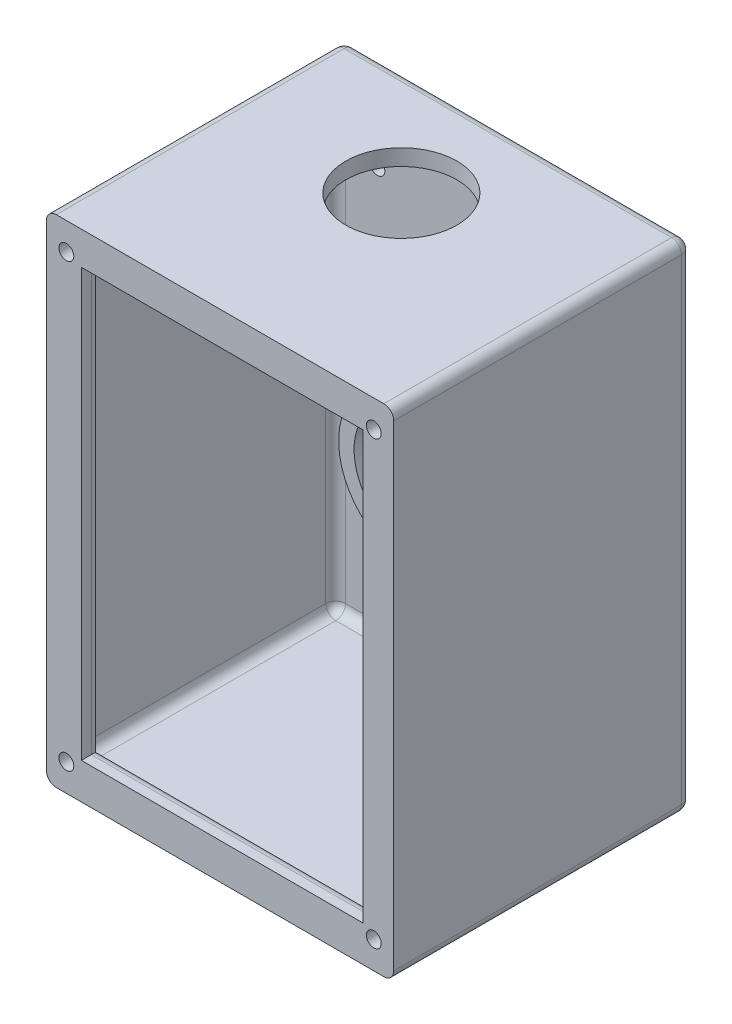
from build123d import *

# Parameters (mm, degrees)
ESBO_O1_W                   = 70
ESBO_O1_H                   = 100
ESBO_O1_R                   = 12
RESSALTO_EXTRUS_O1_DEPTH    = 4
ESBO_O2_R                   = 15.102889219
ESBO_O2_R_2                 = 12
RESSALTO_EXTRUS_O2_DEPTH    = 21
ESBO_O3_W                   = 70
ESBO_O3_H                   = 100
ESBO_O3_W_2                 = 65.412301245
ESBO_O3_H_2                 = 93.446144636
RESSALTO_EXTRUS_O3_DEPTH    = 60
FILETE1_R                   = 2
FILETE2_R                   = 2
FILETE3_R                   = 2
FILETE4_R                   = 2
FILETE5_R                   = 2
CORTE_EXTRUS_O1_DEPTH       = 17
CORTE_EXTRUS_O1_DEPTH_BACK  = 14
ESBO_O4_R                   = 1.5
FILETE6_R                   = 2
FILETE7_R                   = 2
RESSALTO_EXTRUS_O4_DEPTH    = 4
CORTE_EXTRUS_O2_DEPTH       = 4
CORTE_EXTRUS_O2_DEPTH_BACK  = 14
ESBO_O5_R                   = 1.5
FILETE8_R                   = 2
CORTE_EXTRUS_O10_DEPTH      = 32
CORTE_EXTRUS_O10_DEPTH_BACK = 22
ESBO_O6_R                   = 11.2


with BuildPart() as part:
    # Esboço1 → Ressalto-extrusão1 (new body)
    with BuildSketch(Plane.XY):
        with Locations((5.878926005, -32.438162544)):
            Rectangle(ESBO_O1_W, ESBO_O1_H)
        with Locations((5.878926005, -32.438162544)):
            Circle(ESBO_O1_R, mode=Mode.SUBTRACT)
    extrude(amount=RESSALTO_EXTRUS_O1_DEPTH)

    # Esboço2 → Ressalto-extrusão2 (add)
    with BuildSketch(Plane.XY):
        with Locations(Location((5.878926005, -32.438162544, 0), (0, 0, 180))):
            Circle(ESBO_O2_R)
        with Locations((5.878926005, -32.438162544)):
            Circle(ESBO_O2_R_2, mode=Mode.SUBTRACT)
    extrude(amount=RESSALTO_EXTRUS_O2_DEPTH)

    # Esboço3 → Ressalto-extrusão3 (add)
    with BuildSketch(Plane.XY):
        with Locations((5.878926005, -32.438162544)):
            Rectangle(ESBO_O3_W, ESBO_O3_H)
        with Locations((5.878926006, -32.438162544)):
            Rectangle(ESBO_O3_W_2, ESBO_O3_H_2, mode=Mode.SUBTRACT)
    extrude(amount=RESSALTO_EXTRUS_O3_DEPTH)

    # Filete1
    filete1_edges = [part.edges().sort_by_distance(p)[0] for p in [
        (-29.121073995, -32.438162544, 0),
    ]]
    fillet(filete1_edges, radius=FILETE1_R)

    # Filete2
    filete2_edges = [part.edges().sort_by_distance(p)[0] for p in [
        (40.878926005, -32.438162544, 0),
    ]]
    fillet(filete2_edges, radius=FILETE2_R)

    # Filete3
    filete3_edges = [part.edges().sort_by_distance(p)[0] for p in [
        (-26.827224617, -32.438162544, 4),
    ]]
    fillet(filete3_edges, radius=FILETE3_R)

    # Filete4
    filete4_edges = [part.edges().sort_by_distance(p)[0] for p in [
        (-26.827224617, -79.161234862, 33),
        (6.878926005, -79.161234862, 4),
        (38.585076628, -32.438162544, 4),
        (-26.24143818, -79.161234862, 4.585786438),
    ]]
    fillet(filete4_edges, radius=FILETE4_R)

    # Filete5
    filete5_edges = [part.edges().sort_by_distance(p)[0] for p in [
        (38.585076628, 14.284909774, 33),
        (-26.827224617, 14.284909774, 33),
        (5.878926005, 14.284909774, 4),
        (-26.24143818, 14.284909774, 4.585786438),
        (37.99929019, 14.284909774, 4.585786438),
    ]]
    fillet(filete5_edges, radius=FILETE5_R)

    # Esboço4 → Corte-extrusão1 (cut, two sides: drawn at the far end of the back side and taken through both)
    with BuildSketch(Plane.XY.offset(-CORTE_EXTRUS_O1_DEPTH_BACK)):
        with Locations((-18.413897623, 2.265871211)):
            Circle(ESBO_O4_R)
        with Locations((30.171749634, 2.265871211)):
            Circle(ESBO_O4_R)
        with Locations((30.171749634, -67.142196299)):
            Circle(ESBO_O4_R)
        with Locations((-18.413897623, -67.142196299)):
            Circle(ESBO_O4_R)
    extrude(amount=CORTE_EXTRUS_O1_DEPTH + CORTE_EXTRUS_O1_DEPTH_BACK, mode=Mode.SUBTRACT)

    # Filete6
    filete6_edges = [part.edges().sort_by_distance(p)[0] for p in [
        (-28.535287557, 17.561837456, 0.585786438),
        (5.878926005, 17.561837456, 0),
        (40.293139568, 17.561837456, 0.585786438),
        (-29.121073995, 17.561837456, 31),
        (40.878926005, 17.561837456, 31),
    ]]
    fillet(filete6_edges, radius=FILETE6_R)

    # Filete7
    filete7_edges = [part.edges().sort_by_distance(p)[0] for p in [
        (5.878926005, -82.438162544, 0),
        (-28.535287557, -82.438162544, 0.585786438),
        (40.293139568, -82.438162544, 0.585786438),
        (40.878926005, -82.438162544, 31),
        (-29.121073995, -82.438162544, 31),
    ]]
    fillet(filete7_edges, radius=FILETE7_R)

    # 3DSketch1 → Ressalto-extrusão4 (add)
    with BuildSketch(Plane(origin=(-26.827224617, -78.648847783, 60), x_dir=(0.5739296342961376, 0.81890461891279, 0), z_dir=(0, 0, 1))):
        Polygon((0, 0), (-1.957959753, -1.372236887), (36.074200136, -55.637968328), (115.460568304, 0), (77.428408415, 54.265731441), (77.149565293, 54.070304126), (75.833057159, 55.948747976), (-1.316508134, 1.87844385), align=None)
        Polygon((76.062739818, 47.503741973), (108.622178683, 1.046696924), (38.135627574, -48.353831008), (5.57618871, -1.896785959), align=None, mode=Mode.SUBTRACT)
    extrude(amount=-RESSALTO_EXTRUS_O4_DEPTH)

    # Esboço5 → Corte-extrusão2 (cut, two sides: drawn at the far end of the back side and taken through both)
    with BuildSketch(Plane.XY.offset(60).offset(-CORTE_EXTRUS_O2_DEPTH_BACK)):
        with Locations((-25.106275155, 12.052447262)):
            Circle(ESBO_O5_R)
        with Locations((36.864127165, -76.928772351)):
            Circle(ESBO_O5_R)
        with Locations((36.864127165, 12.052447262)):
            Circle(ESBO_O5_R)
        with Locations((-25.106275155, -76.928772351)):
            Circle(ESBO_O5_R)
    extrude(amount=CORTE_EXTRUS_O2_DEPTH + CORTE_EXTRUS_O2_DEPTH_BACK, mode=Mode.SUBTRACT)

    # Filete8
    # the kernel refuses this fillet: 2 mm, written as the material it takes off along each edge
    with BuildSketch(Plane(origin=(-22.073597887, 10.90308644, 56), x_dir=(0, 0, 1), z_dir=(1, 0, 0)), Plane(origin=(34.657117725, -75.171102764, 56), x_dir=(0, 0, 1), z_dir=(-1, 0, 0))) as filete8_piece_1:
        with BuildLine():
            CenterArc((FILETE8_R, -FILETE8_R), FILETE8_R, 90, 90)
            Line((0, -FILETE8_R), (-FILETE8_R * 0.02, -FILETE8_R))
            Line((-FILETE8_R * 0.02, -FILETE8_R), (-FILETE8_R * 0.02, FILETE8_R * 0.02))
            Line((-FILETE8_R * 0.02, FILETE8_R * 0.02), (FILETE8_R, FILETE8_R * 0.02))
            Line((FILETE8_R, FILETE8_R * 0.02), (FILETE8_R, 0))
        make_face()
    extrude(amount=56.730715612, mode=Mode.SUBTRACT)
    with BuildSketch(Plane(origin=(-22.073597887, -75.171102764, 56), x_dir=(0, 0, 1), z_dir=(0, 1, 0)), Plane(origin=(34.657117725, 10.90308644, 56), x_dir=(0, 0, 1), z_dir=(0, -1, 0))) as filete8_piece_2:
        with BuildLine():
            CenterArc((FILETE8_R, -FILETE8_R), FILETE8_R, 90, 90)
            Line((0, -FILETE8_R), (-FILETE8_R * 0.02, -FILETE8_R))
            Line((-FILETE8_R * 0.02, -FILETE8_R), (-FILETE8_R * 0.02, FILETE8_R * 0.02))
            Line((-FILETE8_R * 0.02, FILETE8_R * 0.02), (FILETE8_R, FILETE8_R * 0.02))
            Line((FILETE8_R, FILETE8_R * 0.02), (FILETE8_R, 0))
        make_face()
    extrude(amount=86.074189204, mode=Mode.SUBTRACT)
    with BuildSketch(Plane(origin=(-27.073597887, 10.90308644, 56), x_dir=(0, 0, 1), z_dir=(1, 0, 0))) as filete8_piece_3a_section:
        with BuildLine():
            CenterArc((FILETE8_R, -FILETE8_R), FILETE8_R, 90, 90)
            Line((0, -FILETE8_R), (-FILETE8_R * 0.02, -FILETE8_R))
            Line((-FILETE8_R * 0.02, -FILETE8_R), (-FILETE8_R * 0.02, FILETE8_R * 0.02))
            Line((-FILETE8_R * 0.02, FILETE8_R * 0.02), (FILETE8_R, FILETE8_R * 0.02))
            Line((FILETE8_R, FILETE8_R * 0.02), (FILETE8_R, 0))
        make_face()
    filete8_piece_3a = extrude(amount=61.730715612, mode=Mode.PRIVATE)
    filete8_piece_3a = split(filete8_piece_3a, bisect_by=Plane(origin=(-22.073597887, 11.355876668, 56.452790229), z_dir=(-1, 0, 0)), keep=Keep.TOP, mode=Mode.PRIVATE)
    with BuildSketch(Plane(origin=(-22.073597887, -75.171102764, 56), x_dir=(0, 0, 1), z_dir=(0, 1, 0))) as filete8_piece_3b_section:
        with BuildLine():
            CenterArc((FILETE8_R, -FILETE8_R), FILETE8_R, 90, 90)
            Line((0, -FILETE8_R), (-FILETE8_R * 0.02, -FILETE8_R))
            Line((-FILETE8_R * 0.02, -FILETE8_R), (-FILETE8_R * 0.02, FILETE8_R * 0.02))
            Line((-FILETE8_R * 0.02, FILETE8_R * 0.02), (FILETE8_R, FILETE8_R * 0.02))
            Line((FILETE8_R, FILETE8_R * 0.02), (FILETE8_R, 0))
        make_face()
    filete8_piece_3b = extrude(amount=91.074189204, mode=Mode.PRIVATE)
    filete8_piece_3b = split(filete8_piece_3b, bisect_by=Plane(origin=(-22.526388116, 10.90308644, 56.452790229), z_dir=(0, 1, 0)), keep=Keep.TOP, mode=Mode.PRIVATE)
    filete8_piece_3 = filete8_piece_3a & filete8_piece_3b
    add(filete8_piece_3, mode=Mode.SUBTRACT)
    with BuildSketch(Plane(origin=(34.657117725, 15.90308644, 56), x_dir=(0, 0, 1), z_dir=(0, -1, 0))) as filete8_piece_4a_section:
        with BuildLine():
            CenterArc((FILETE8_R, -FILETE8_R), FILETE8_R, 90, 90)
            Line((0, -FILETE8_R), (-FILETE8_R * 0.02, -FILETE8_R))
            Line((-FILETE8_R * 0.02, -FILETE8_R), (-FILETE8_R * 0.02, FILETE8_R * 0.02))
            Line((-FILETE8_R * 0.02, FILETE8_R * 0.02), (FILETE8_R, FILETE8_R * 0.02))
            Line((FILETE8_R, FILETE8_R * 0.02), (FILETE8_R, 0))
        make_face()
    filete8_piece_4a = extrude(amount=91.074189204, mode=Mode.PRIVATE)
    filete8_piece_4a = split(filete8_piece_4a, bisect_by=Plane(origin=(35.109907953, 10.90308644, 56.452790229), z_dir=(0, 1, 0)), keep=Keep.TOP, mode=Mode.PRIVATE)
    with BuildSketch(Plane(origin=(-22.073597887, 10.90308644, 56), x_dir=(0, 0, 1), z_dir=(1, 0, 0))) as filete8_piece_4b_section:
        with BuildLine():
            CenterArc((FILETE8_R, -FILETE8_R), FILETE8_R, 90, 90)
            Line((0, -FILETE8_R), (-FILETE8_R * 0.02, -FILETE8_R))
            Line((-FILETE8_R * 0.02, -FILETE8_R), (-FILETE8_R * 0.02, FILETE8_R * 0.02))
            Line((-FILETE8_R * 0.02, FILETE8_R * 0.02), (FILETE8_R, FILETE8_R * 0.02))
            Line((FILETE8_R, FILETE8_R * 0.02), (FILETE8_R, 0))
        make_face()
    filete8_piece_4b = extrude(amount=61.730715612, mode=Mode.PRIVATE)
    filete8_piece_4b = split(filete8_piece_4b, bisect_by=Plane(origin=(34.657117725, 11.355876668, 56.452790229), z_dir=(1, 0, 0)), keep=Keep.TOP, mode=Mode.PRIVATE)
    filete8_piece_4 = filete8_piece_4a & filete8_piece_4b
    add(filete8_piece_4, mode=Mode.SUBTRACT)
    with BuildSketch(Plane(origin=(34.657117725, -75.171102764, 56), x_dir=(0, 0, 1), z_dir=(-1, 0, 0))) as filete8_piece_5a_section:
        with BuildLine():
            CenterArc((FILETE8_R, -FILETE8_R), FILETE8_R, 90, 90)
            Line((0, -FILETE8_R), (-FILETE8_R * 0.02, -FILETE8_R))
            Line((-FILETE8_R * 0.02, -FILETE8_R), (-FILETE8_R * 0.02, FILETE8_R * 0.02))
            Line((-FILETE8_R * 0.02, FILETE8_R * 0.02), (FILETE8_R, FILETE8_R * 0.02))
            Line((FILETE8_R, FILETE8_R * 0.02), (FILETE8_R, 0))
        make_face()
    filete8_piece_5a = extrude(amount=61.730715612, mode=Mode.PRIVATE)
    filete8_piece_5a = split(filete8_piece_5a, bisect_by=Plane(origin=(-22.073597887, -75.623892993, 56.452790229), z_dir=(-1, 0, 0)), keep=Keep.TOP, mode=Mode.PRIVATE)
    with BuildSketch(Plane(origin=(-22.073597887, -80.171102764, 56), x_dir=(0, 0, 1), z_dir=(0, 1, 0))) as filete8_piece_5b_section:
        with BuildLine():
            CenterArc((FILETE8_R, -FILETE8_R), FILETE8_R, 90, 90)
            Line((0, -FILETE8_R), (-FILETE8_R * 0.02, -FILETE8_R))
            Line((-FILETE8_R * 0.02, -FILETE8_R), (-FILETE8_R * 0.02, FILETE8_R * 0.02))
            Line((-FILETE8_R * 0.02, FILETE8_R * 0.02), (FILETE8_R, FILETE8_R * 0.02))
            Line((FILETE8_R, FILETE8_R * 0.02), (FILETE8_R, 0))
        make_face()
    filete8_piece_5b = extrude(amount=91.074189204, mode=Mode.PRIVATE)
    filete8_piece_5b = split(filete8_piece_5b, bisect_by=Plane(origin=(-22.526388116, -75.171102764, 56.452790229), z_dir=(0, -1, 0)), keep=Keep.TOP, mode=Mode.PRIVATE)
    filete8_piece_5 = filete8_piece_5a & filete8_piece_5b
    add(filete8_piece_5, mode=Mode.SUBTRACT)
    with BuildSketch(Plane(origin=(34.657117725, 10.90308644, 56), x_dir=(0, 0, 1), z_dir=(0, -1, 0))) as filete8_piece_6a_section:
        with BuildLine():
            CenterArc((FILETE8_R, -FILETE8_R), FILETE8_R, 90, 90)
            Line((0, -FILETE8_R), (-FILETE8_R * 0.02, -FILETE8_R))
            Line((-FILETE8_R * 0.02, -FILETE8_R), (-FILETE8_R * 0.02, FILETE8_R * 0.02))
            Line((-FILETE8_R * 0.02, FILETE8_R * 0.02), (FILETE8_R, FILETE8_R * 0.02))
            Line((FILETE8_R, FILETE8_R * 0.02), (FILETE8_R, 0))
        make_face()
    filete8_piece_6a = extrude(amount=91.074189204, mode=Mode.PRIVATE)
    filete8_piece_6a = split(filete8_piece_6a, bisect_by=Plane(origin=(35.109907953, -75.171102764, 56.452790229), z_dir=(0, -1, 0)), keep=Keep.TOP, mode=Mode.PRIVATE)
    with BuildSketch(Plane(origin=(39.657117725, -75.171102764, 56), x_dir=(0, 0, 1), z_dir=(-1, 0, 0))) as filete8_piece_6b_section:
        with BuildLine():
            CenterArc((FILETE8_R, -FILETE8_R), FILETE8_R, 90, 90)
            Line((0, -FILETE8_R), (-FILETE8_R * 0.02, -FILETE8_R))
            Line((-FILETE8_R * 0.02, -FILETE8_R), (-FILETE8_R * 0.02, FILETE8_R * 0.02))
            Line((-FILETE8_R * 0.02, FILETE8_R * 0.02), (FILETE8_R, FILETE8_R * 0.02))
            Line((FILETE8_R, FILETE8_R * 0.02), (FILETE8_R, 0))
        make_face()
    filete8_piece_6b = extrude(amount=61.730715612, mode=Mode.PRIVATE)
    filete8_piece_6b = split(filete8_piece_6b, bisect_by=Plane(origin=(34.657117725, -75.623892993, 56.452790229), z_dir=(1, 0, 0)), keep=Keep.TOP, mode=Mode.PRIVATE)
    filete8_piece_6 = filete8_piece_6a & filete8_piece_6b
    add(filete8_piece_6, mode=Mode.SUBTRACT)

    # Esboço6 → Corte-extrusão10 (cut, two sides: drawn at the far end of the back side and taken through both)
    with BuildSketch(Plane(origin=(0, 0, 0), x_dir=(1, 0, 0), z_dir=(0, 1, 0)).offset(-CORTE_EXTRUS_O10_DEPTH_BACK)):
        with Locations(Location((3.878926005, -21.462549215, 0), (0, 0, 90))):
            Circle(ESBO_O6_R)
    extrude(amount=CORTE_EXTRUS_O10_DEPTH + CORTE_EXTRUS_O10_DEPTH_BACK, mode=Mode.SUBTRACT)


solid = part.part
